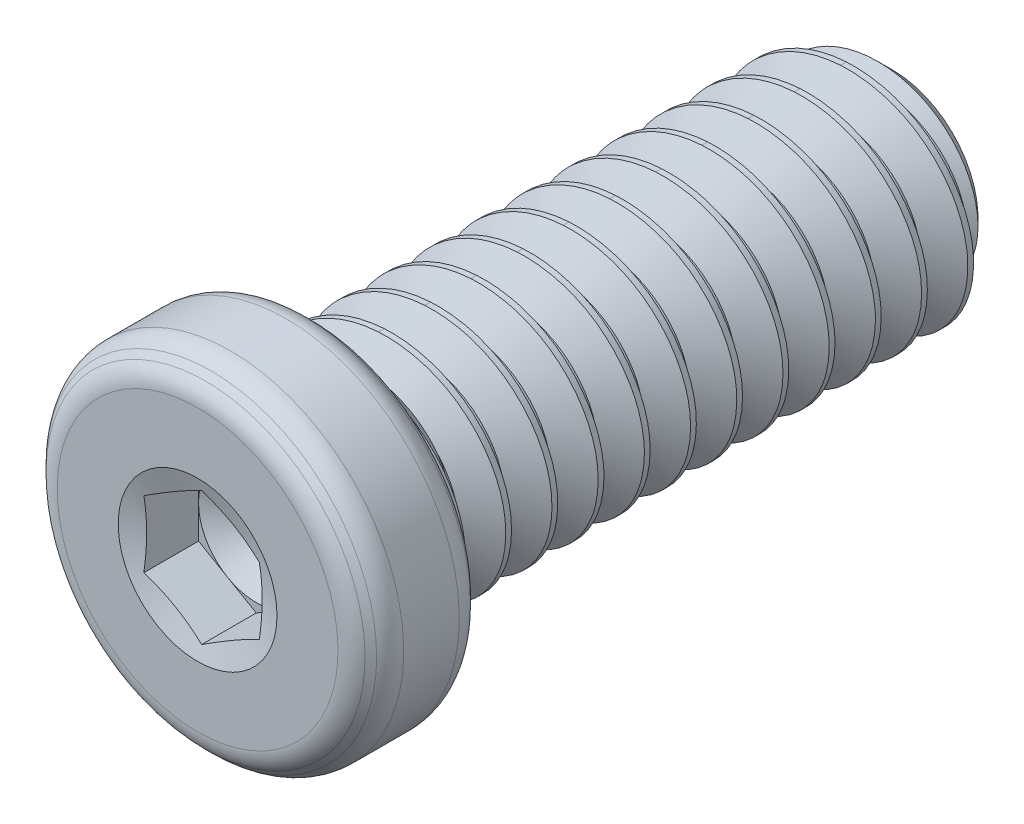
from build123d import *

# Parameters (mm, degrees)
CUT_EXTRUDE1_DEPTH = 1.6129


# Read off the part's stored shape, not the designer's step: Split1
with BuildPart() as part:
    # Sketch3 → Revolve1 (revolve)
    with BuildSketch(Plane(origin=(0, 0, 0), x_dir=(0, 0, -1), z_dir=(1, 0, 0)), mode=Mode.PRIVATE) as revolve1_sk:
        with BuildLine():
            Line((-9.5504, 3.858954361), (-9.5504, 1.5875))
            Line((-9.5504, 1.5875), (-7.9375, 1.5875))
            Line((-7.9375, 1.5875), (-7.9375, 0))
            Line((-7.9375, 0), (9.5504, 0))
            Line((9.5504, 0), (9.5504, 2.350110803))
            Line((9.5504, 2.350110803), (8.725510803, 3.175))
            Line((8.725510803, 3.175), (-6.3246, 3.175))
            Line((-6.3246, 3.175), (-6.3246, 4.122047802))
            ThreePointArc((-6.3246, 4.122047802), (-6.352922166, 4.264432946), (-6.433576871, 4.385141243))
            Line((-6.433576871, 4.385141243), (-6.592981886, 4.544546257))
            ThreePointArc((-6.592981886, 4.544546257), (-6.834398479, 4.705855668), (-7.119168768, 4.7625))
            Line((-7.119168768, 4.7625), (-8.646854361, 4.7625))
            ThreePointArc((-8.646854361, 4.7625), (-8.931624649, 4.705855668), (-9.173041243, 4.544546257))
            Line((-9.173041243, 4.544546257), (-9.332446257, 4.385141243))
            ThreePointArc((-9.332446257, 4.385141243), (-9.493755668, 4.143724649), (-9.5504, 3.858954361))
        make_face()
    revolve(revolve1_sk.sketch.rotate(Axis((0, 0, 9.5504), (0, 0, -1)), 180), axis=Axis((0, 0, 9.5504), (0, 0, -1)))

    # Sketch4 → Cut-Extrude1 (cut)
    with BuildSketch(Plane.XY.offset(9.5504)):
        Polygon((0, 1.833087105), (-1.5875, 0.916543552), (-1.5875, -0.916543552), (0, -1.833087105), (1.5875, -0.916543552), (1.5875, 0.916543552), align=None)
    extrude(amount=-CUT_EXTRUDE1_DEPTH, mode=Mode.SUBTRACT)

    # Cut-Extrude2 cone 1 section (through the dimple's axis) → Cut-Extrude2 (revolve, cut)
    with BuildSketch(Plane(origin=(0, 0, 9.5504), x_dir=(0, -1, 0), z_dir=(1, 0, 0))):
        Polygon((0, 0), (2.1828125, 0), (0, 0.688238138), align=None)
    revolve(axis=Axis((0, 0, 9.5504), (0, 0, -1)), mode=Mode.SUBTRACT)

    # Cut-Extrude3 cone 1 section (through the dimple's axis) → Cut-Extrude3 (revolve, cut)
    with BuildSketch(Plane(origin=(0, 0, 7.9375), x_dir=(0, -1, 0), z_dir=(1, 0, 0))):
        Polygon((0, 0), (1.5875, 0), (0, 0.916543552), align=None)
    revolve(axis=Axis((0, 0, 7.9375), (0, 0, -1)), mode=Mode.SUBTRACT)


with BuildPart() as body_2:
    # Split1: the piece on the far side of the plane
    add(part.part)
    split(bisect_by=Plane.XY.offset(6.3246), keep=Keep.BOTTOM)

    # Cut-Sweep1: sweep along a curve in space
    with BuildLine() as cut_sweep1_path:
        add(Edge.make_bspline(
            [(0, 3.175, -9.5504), (-0.414921129, 3.175, -9.523985301), (-1.253894271, 3.008061858, -9.470561975), (-2.312483334, 2.295326865, -9.390904413), (-3.017568743, 1.229808776, -9.311118925), (-3.25835172, -0.02472629, -9.231367714), (-2.998475895, -1.275461019, -9.151607319), (-2.277708749, -2.330162193, -9.071849385), (-1.206876224, -3.026726211, -8.992090792), (0.049451278, -3.258093809, -8.912332375), (1.298177597, -2.988704658, -8.832573911), (2.347379097, -2.259962854, -8.75281546), (3.035797218, -1.183873271, -8.673057005), (3.257624753, 0.074173176, -8.593298551), (2.978767626, 1.320819485, -8.513540097), (2.242085134, 2.364460814, -8.433781643), (1.160802599, 3.044693418, -8.354023188), (-0.098890924, 3.25696811, -8.274264734), (-1.343385285, 2.968659068, -8.19450628), (-2.381406386, 2.224078306, -8.114747826), (-3.053414293, 1.137665084, -8.034989372), (-3.256123921, -0.123602978, -7.955230918), (-2.958379565, -1.365873727, -7.875472464), (-2.205943409, -2.398214828, -7.79571401), (-1.114462059, -3.061959341, -7.715955556), (0.148307914, -3.255092234, -7.636197101), (1.388283518, -2.947929707, -7.556438647), (2.414885173, -2.187681486, -7.476680193), (3.070328072, -1.091194859, -7.396921739), (3.253873107, 0.173004309, -7.317163285), (2.937310099, 1.410613367, -7.237404831), (2.169293589, 2.431416462, -7.157646377), (1.067864824, 3.078520002, -7.077887923), (-0.197690743, 3.252466611, -6.998129469), (-1.432861988, 2.92652135, -6.918371014), (-2.447807741, 2.150780777, -6.83861256), (-3.086534661, 1.044473298, -6.758854106), (-3.250872827, -0.222365793, -6.679095652), (-2.915564082, -1.4550281, -6.599337198), (-2.132144116, -2.464058067, -6.519578744), (-1.021021628, -3.094371587, -6.43982029), (0.247028039, -3.249091848, -6.360061836), (1.477110426, -2.904438926, -6.280303382), (2.480166504, -2.113384679, -6.200544928), (3.102030329, -0.997511164, -6.120786473), (3.247123774, 0.27167606, -6.041028019), (2.893146523, 1.499107696, -5.961269565), (2.094503545, 2.496132125, -5.881511111), (0.97394326, 3.109510446, -5.801752657), (-0.296308436, 3.244968721, -5.721994203), (-1.521018642, 2.881687522, -5.642235749), (-2.51195401, 2.075501804, -5.562477295), (-3.116811506, 0.950319273, -5.482718841), (-3.242626811, -0.320923751, -5.402960386), (-2.870062585, -1.542842003, -5.323201932), (-2.056380548, -2.527631249, -5.243443478), (-0.926640564, -3.12393309, -5.163685024), (0.345520585, -3.240098179, -5.08392657), (1.564576521, -2.85827238, -5.004168116), (2.543162938, -2.037140878, -4.924409662), (3.130874788, -0.902908495, -4.844651208), (3.237382972, 0.370097523, -4.764892754), (2.846317585, 1.586220946, -4.6851343), (2.017783904, 2.558548183, -4.605375845), (0.879124434, 3.137636199, -4.525617391), (-0.39465315, 3.234481346, -4.445858937), (-1.607774031, 2.83419889, -4.366100483), (-2.573786098, 1.998310738, -4.286342029), (-3.144216934, 0.85528975, -4.206583575), (-3.231393467, -0.419186051, -4.126825121), (-2.821916993, -1.629234535, -4.047066667), (-1.978722503, -2.588875807, -3.967308213), (-0.831405816, -3.150616615, -3.887549758), (0.443694815, -3.228119514, -3.807791304), (1.650601223, -2.8094726, -3.72803285), (2.603816439, -1.959020327, -3.648274396), (3.156834873, -0.807474006, -3.568515942), (3.224659675, 0.468178028, -3.488757488), (2.796866428, 1.671872863, -3.408999034), (1.939205343, 2.618607134, -3.32924058), (0.7834957, 3.16287135, -3.249482126), (-0.492634283, 3.221014149, -3.169723671), (-1.693048231, 2.784099203, -3.089965217), (-2.633247042, 1.919278694, -3.010206763), (-3.168725698, 0.759472277, -2.930448309), (-3.217183147, -0.51706217, -2.850689855), (-2.771171661, -1.714126108, -2.770931401), (-1.899241526, -2.647735318, -2.691172947), (-0.735405121, -3.17439758, -2.611414493), (0.541460282, -3.213166888, -2.531656039), (1.735105279, -2.758084545, -2.451897585), (2.662071128, -1.879094993, -2.37213913), (3.17988667, -0.711295618, -2.292380676), (3.208965604, 0.565827216, -2.212622222), (2.744838609, 1.755984538, -2.132863768), (1.858840256, 2.676253648, -2.053105314), (0.687145156, 3.185192651, -1.97334686), (-0.590161568, 3.204579537, -1.893588406), (-1.77676268, 2.731434616, -1.813829952), (-2.69028206, 1.838478481, -1.734071498), (-3.190315218, 0.662955126, -1.654313043), (-3.20000894, -0.614461936, -1.574554589), (-2.717873339, -1.797438511, -1.494796135), (-1.81801084, -2.704155556, -1.415037681), (-0.638726921, -3.195254076, -1.335279227), (0.638726921, -3.195254076, -1.255520773), (1.81801084, -2.704155556, -1.175762319), (2.717873339, -1.797438511, -1.096003865), (3.20000894, -0.614461936, -1.016245411), (3.190315218, 0.662955126, -0.936486957), (2.69028206, 1.838478481, -0.856728502), (1.77676268, 2.731434616, -0.776970048), (0.590161568, 3.204579537, -0.697211594), (-0.687145156, 3.185192651, -0.61745314), (-1.858840256, 2.676253648, -0.537694686), (-2.744838609, 1.755984538, -0.457936232), (-3.208965604, 0.565827216, -0.378177778), (-3.17988667, -0.711295618, -0.298419324), (-2.662071128, -1.879094993, -0.21866087), (-1.735105279, -2.758084545, -0.138902415), (-0.541460282, -3.213166888, -0.059143961), (0.735405121, -3.17439758, 0.020614493), (1.899241526, -2.647735318, 0.100372947), (2.771171661, -1.714126108, 0.180131401), (3.217183147, -0.51706217, 0.259889855), (3.168725698, 0.759472277, 0.339648309), (2.633247042, 1.919278694, 0.419406763), (1.693048231, 2.784099203, 0.499165217), (0.492634283, 3.221014149, 0.578923671), (-0.7834957, 3.16287135, 0.658682126), (-1.939205343, 2.618607134, 0.73844058), (-2.796866428, 1.671872863, 0.818199034), (-3.224659675, 0.468178028, 0.897957488), (-3.156834873, -0.807474006, 0.977715942), (-2.603816439, -1.959020327, 1.057474396), (-1.650601223, -2.8094726, 1.13723285), (-0.443694815, -3.228119514, 1.216991304), (0.831405816, -3.150616615, 1.296749758), (1.978722503, -2.588875807, 1.376508213), (2.821916993, -1.629234535, 1.456266667), (3.231393467, -0.419186051, 1.536025121), (3.144216934, 0.85528975, 1.615783575), (2.573786098, 1.998310738, 1.695542029), (1.607774031, 2.83419889, 1.775300483), (0.39465315, 3.234481346, 1.855058937), (-0.879124434, 3.137636199, 1.934817391), (-2.017783904, 2.558548183, 2.014575845), (-2.846317585, 1.586220946, 2.0943343), (-3.237382972, 0.370097523, 2.174092754), (-3.130874788, -0.902908495, 2.253851208), (-2.543162938, -2.037140878, 2.333609662), (-1.564576521, -2.85827238, 2.413368116), (-0.345520585, -3.240098179, 2.49312657), (0.926640564, -3.12393309, 2.572885024), (2.056380548, -2.527631249, 2.652643478), (2.870062585, -1.542842003, 2.732401932), (3.242626811, -0.320923751, 2.812160386), (3.116811506, 0.950319273, 2.891918841), (2.51195401, 2.075501804, 2.971677295), (1.521018642, 2.881687522, 3.051435749), (0.296308436, 3.244968721, 3.131194203), (-0.97394326, 3.109510446, 3.210952657), (-2.094503545, 2.496132125, 3.290711111), (-2.893146523, 1.499107696, 3.370469565), (-3.247123774, 0.27167606, 3.450228019), (-3.102030329, -0.997511164, 3.529986473), (-2.480166504, -2.113384679, 3.609744928), (-1.477110426, -2.904438926, 3.689503382), (-0.247028039, -3.249091848, 3.769261836), (1.021021628, -3.094371587, 3.84902029), (2.132144116, -2.464058067, 3.928778744), (2.915564082, -1.4550281, 4.008537198), (3.250872827, -0.222365793, 4.088295652), (3.086534661, 1.044473298, 4.168054106), (2.447807741, 2.150780777, 4.24781256), (1.432861988, 2.92652135, 4.327571014), (0.197690743, 3.252466611, 4.407329469), (-1.067864824, 3.078520002, 4.487087923), (-2.169293589, 2.431416462, 4.566846377), (-2.937310099, 1.410613367, 4.646604831), (-3.253873107, 0.173004309, 4.726363285), (-3.070328072, -1.091194859, 4.806121739), (-2.414885173, -2.187681486, 4.885880193), (-1.388283518, -2.947929707, 4.965638647), (-0.148307914, -3.255092234, 5.045397101), (1.114462059, -3.061959341, 5.125155556), (2.205943409, -2.398214828, 5.20491401), (2.958379565, -1.365873727, 5.284672464), (3.256123921, -0.123602978, 5.364430918), (3.053414293, 1.137665084, 5.444189372), (2.381406386, 2.224078306, 5.523947826), (1.343385285, 2.968659068, 5.60370628), (0.098890924, 3.25696811, 5.683464734), (-1.160802599, 3.044693418, 5.763223188), (-2.242085134, 2.364460814, 5.842981643), (-2.978767626, 1.320819485, 5.922740097), (-3.257624753, 0.074173176, 6.002498551), (-3.035797218, -1.183873271, 6.082257005), (-2.347379097, -2.259962854, 6.16201546), (-1.298177597, -2.988704658, 6.241773911), (-0.049451278, -3.258093809, 6.321532375), (1.206876224, -3.026726211, 6.401290792), (2.277708749, -2.330162193, 6.481049385), (2.998475895, -1.275461019, 6.560807319), (3.25835172, -0.02472629, 6.640567714), (3.017568743, 1.229808776, 6.720318925), (2.312483334, 2.295326865, 6.800104413), (1.253894271, 3.008061858, 6.879761975), (0.414921129, 3.175, 6.933185301), (0, 3.175, 6.9596)],
            knots=[0, 0, 0, 0, 0.004830918, 0.009661836, 0.014492754, 0.019323671, 0.024154589, 0.028985507, 0.033816425, 0.038647343, 0.043478261, 0.048309179, 0.053140097, 0.057971014, 0.062801932, 0.06763285, 0.072463768, 0.077294686, 0.082125604, 0.086956522, 0.09178744, 0.096618357, 0.101449275, 0.106280193, 0.111111111, 0.115942029, 0.120772947, 0.125603865, 0.130434783, 0.1352657, 0.140096618, 0.144927536, 0.149758454, 0.154589372, 0.15942029, 0.164251208, 0.169082126, 0.173913043, 0.178743961, 0.183574879, 0.188405797, 0.193236715, 0.198067633, 0.202898551, 0.207729469, 0.212560386, 0.217391304, 0.222222222, 0.22705314, 0.231884058, 0.236714976, 0.241545894, 0.246376812, 0.251207729, 0.256038647, 0.260869565, 0.265700483, 0.270531401, 0.275362319, 0.280193237, 0.285024155, 0.289855072, 0.29468599, 0.299516908, 0.304347826, 0.309178744, 0.314009662, 0.31884058, 0.323671498, 0.328502415, 0.333333333, 0.338164251, 0.342995169, 0.347826087, 0.352657005, 0.357487923, 0.362318841, 0.367149758, 0.371980676, 0.376811594, 0.381642512, 0.38647343, 0.391304348, 0.396135266, 0.400966184, 0.405797101, 0.410628019, 0.415458937, 0.420289855, 0.425120773, 0.429951691, 0.434782609, 0.439613527, 0.444444444, 0.449275362, 0.45410628, 0.458937198, 0.463768116, 0.468599034, 0.473429952, 0.47826087, 0.483091787, 0.487922705, 0.492753623, 0.497584541, 0.502415459, 0.507246377, 0.512077295, 0.516908213, 0.52173913, 0.526570048, 0.531400966, 0.536231884, 0.541062802, 0.54589372, 0.550724638, 0.555555556, 0.560386473, 0.565217391, 0.570048309, 0.574879227, 0.579710145, 0.584541063, 0.589371981, 0.594202899, 0.599033816, 0.603864734, 0.608695652, 0.61352657, 0.618357488, 0.623188406, 0.628019324, 0.632850242, 0.637681159, 0.642512077, 0.647342995, 0.652173913, 0.657004831, 0.661835749, 0.666666667, 0.671497585, 0.676328502, 0.68115942, 0.685990338, 0.690821256, 0.695652174, 0.700483092, 0.70531401, 0.710144928, 0.714975845, 0.719806763, 0.724637681, 0.729468599, 0.734299517, 0.739130435, 0.743961353, 0.748792271, 0.753623188, 0.758454106, 0.763285024, 0.768115942, 0.77294686, 0.777777778, 0.782608696, 0.787439614, 0.792270531, 0.797101449, 0.801932367, 0.806763285, 0.811594203, 0.816425121, 0.821256039, 0.826086957, 0.830917874, 0.835748792, 0.84057971, 0.845410628, 0.850241546, 0.855072464, 0.859903382, 0.8647343, 0.869565217, 0.874396135, 0.879227053, 0.884057971, 0.888888889, 0.893719807, 0.898550725, 0.903381643, 0.90821256, 0.913043478, 0.917874396, 0.922705314, 0.927536232, 0.93236715, 0.937198068, 0.942028986, 0.946859903, 0.951690821, 0.956521739, 0.961352657, 0.966183575, 0.971014493, 0.975845411, 0.980676329, 0.985507246, 0.990338164, 0.995169082, 1, 1, 1, 1], degree=3))
    # Sketch7 → Cut-Sweep1 (sweep, cut)
    with BuildSketch(Plane(origin=(0, 0, 0), x_dir=(0, 0, -1), z_dir=(1, 0, 0))):
        Polygon((10.02665, 2.350110803), (10.1854, 2.350110803), (10.7013375, 3.243740766), (9.5107125, 3.243740766), align=None)
    sweep(path=cut_sweep1_path.line, is_frenet=True, mode=Mode.SUBTRACT)


with BuildPart() as part_1:
    add(part.part)

    # Split1
    split(bisect_by=Plane.XY.offset(6.3246), keep=Keep.TOP)

    add(body_2.part)  # Revolve2 merges body 2
    # Sketch11 → Revolve2 (revolve)
    with BuildSketch(Plane(origin=(0, 0, 0), x_dir=(0, 0, -1), z_dir=(1, 0, 0))):
        Polygon((-6.3246, 3.4925), (-6.0071, 3.175), (-5.6896, 3.175), (-2.5146, 0), (-6.3246, 0), (-7.020956448, 0), (-7.020956448, 3.4925), align=None)
    revolve(axis=Axis((0, 0, 2.5146), (0, 0, 1)))


solid = part_1.part
